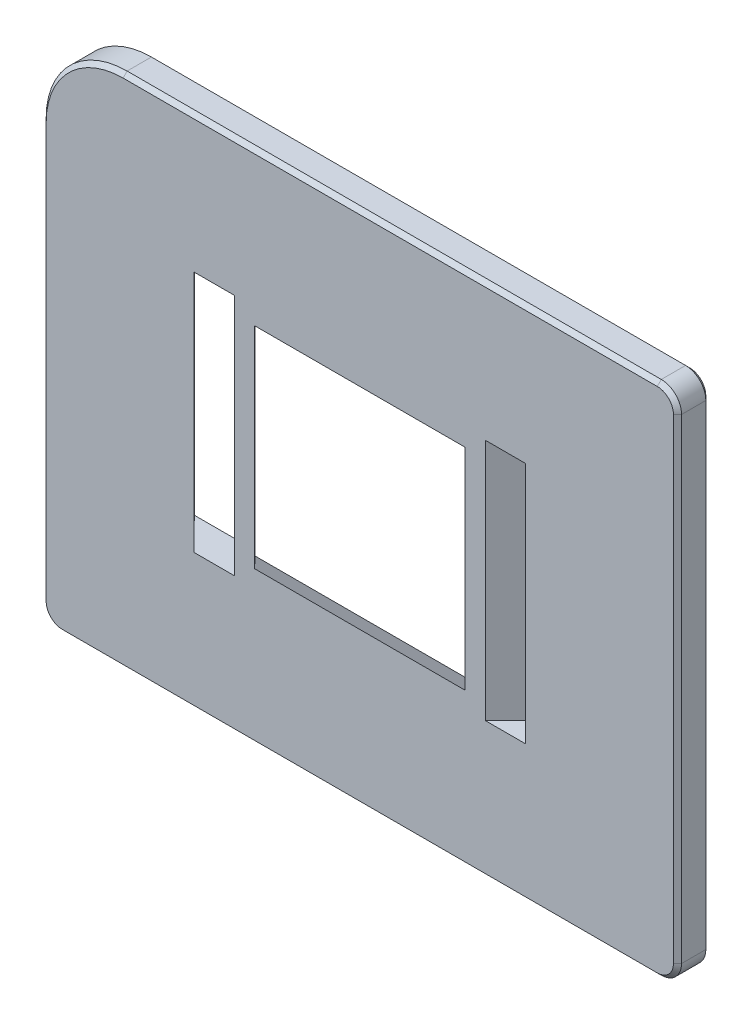
from build123d import *
from OCP.BRepFilletAPI import BRepFilletAPI_MakeFillet

# Parameters (mm, degrees)
SKETCH1_W           = 157
SKETCH1_H           = 127.5
BOSS_EXTRUDE1_DEPTH = 4
FILLET1_R1          = 20
FILLET1_R2          = 5
CHAMFER1_SIZE       = 1


with BuildPart() as part:
    # Sketch1 → Boss-Extrude1 (new, symmetric)
    with BuildSketch(Plane.XY):
        Rectangle(SKETCH1_W, SKETCH1_H)
    extrude(amount=BOSS_EXTRUDE1_DEPTH, both=True)

    # Sketch2 → Cut-Loft1 section 0
    with BuildSketch(Plane.XY.offset(4)):
        with BuildLine():
            Line((-26, -26), (26, -26))
            Line((26, -26), (26, 26))
            Line((26, 26), (-26, 26))
            Line((-26, 26), (-26, -26))
        make_face()
    # Sketch4 → Cut-Loft1 section 1
    with BuildSketch(Plane.XY.offset(-34)):
        with BuildLine():
            Line((63.5, -50.8), (-63.5, -50.8))
            Line((-63.5, -50.8), (-63.5, 50.8))
            Line((-63.5, 50.8), (63.5, 50.8))
            Line((63.5, 50.8), (63.5, -50.8))
        make_face()
    loft(mode=Mode.SUBTRACT)

    # Sketch5 → Cut-Loft2 section 0
    with BuildSketch(Plane.XY.offset(4)):
        with BuildLine():
            Line((-31, 30), (-41, 30))
            Line((-41, 30), (-41, -30))
            Line((-41, -30), (-31, -30))
            Line((-31, -30), (-31, 30))
        make_face()
    # Sketch6 → Cut-Loft2 section 1
    with BuildSketch(Plane(origin=(0, 0, -4), x_dir=(-1, 0, 0), z_dir=(0, 0, -1))):
        with BuildLine():
            Line((38.894736842, 30), (48.894736842, 30))
            Line((48.894736842, 30), (48.894736842, -30))
            Line((48.894736842, -30), (38.894736842, -30))
            Line((38.894736842, -30), (38.894736842, 30))
        make_face()
    cut_loft2 = loft(mode=Mode.SUBTRACT)

    # Mirror1: Cut-Loft2 across plane
    add(cut_loft2.mirror(Plane(origin=(0, 0, 0), x_dir=(0, 0, 1), z_dir=(1, 0, 0))), mode=Mode.SUBTRACT)

    # Fillet1: one fillet with a radius per group of edges: ONE call of the kernel's fillet builder (fillet() takes one radius for all edges)
    fillet1_edges_1 = [part.edges().sort_by_distance(p)[0] for p in [
        (-78.5, 63.75, 0),
    ]]
    fillet1_edges_2 = [part.edges().sort_by_distance(p)[0] for p in [
        (78.5, 63.75, 0),
        (78.5, -63.75, 0),
        (-78.5, -63.75, 0),
    ]]
    fillet1 = BRepFilletAPI_MakeFillet(part.part.solid().wrapped)
    for e in fillet1_edges_1:
        fillet1.Add(FILLET1_R1, e.wrapped)
    for e in fillet1_edges_2:
        fillet1.Add(FILLET1_R2, e.wrapped)
    add(Compound.cast(fillet1.Shape()), mode=Mode.REPLACE)

    # Chamfer1
    chamfer1_edges = [part.edges().sort_by_distance(p)[0] for p in [
        (-78.5, -7.5, 4),
        (-77.035533906, -62.285533906, 4),
        (-72.642135624, 57.892135624, 4),
        (0, -63.75, 4),
        (7.5, 63.75, 4),
        (77.035533906, -62.285533906, 4),
        (77.035533906, 62.285533906, 4),
        (78.5, 0, 4),
        (-78.5, -7.5, -4),
        (-77.035533906, -62.285533906, -4),
        (-72.642135624, 57.892135624, -4),
        (0, -63.75, -4),
        (7.5, 63.75, -4),
        (77.035533906, -62.285533906, -4),
        (77.035533906, 62.285533906, -4),
        (78.5, 0, -4),
    ]]
    chamfer(chamfer1_edges, length=CHAMFER1_SIZE)


solid = part.part
